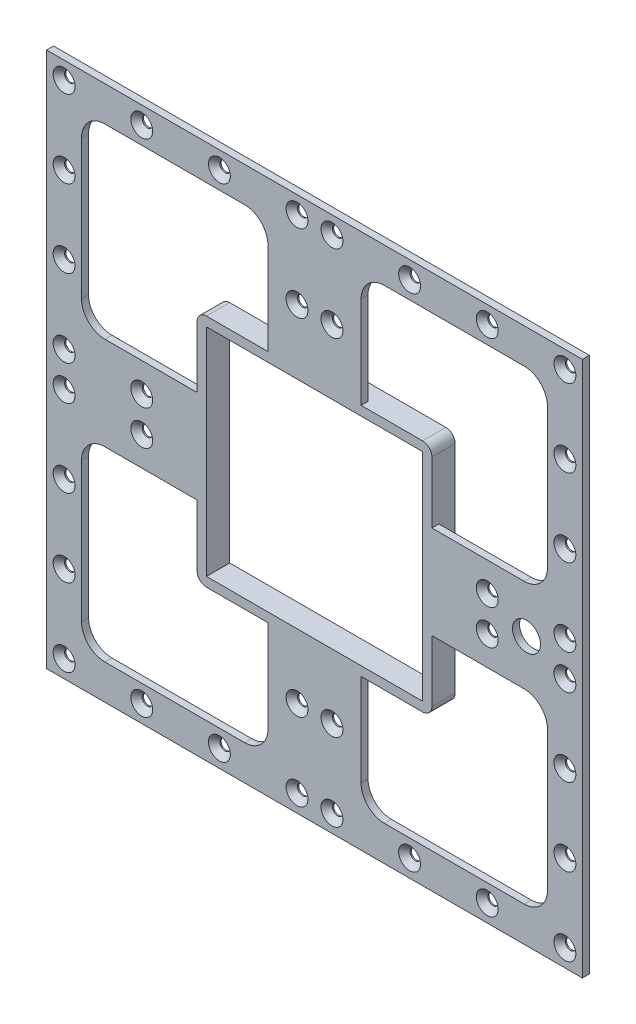
from build123d import *

# Parameters (mm, degrees)
SKETCH1_W              = 230
SKETCH1_H              = 230
BOSS_EXTRUDE1_DEPTH    = 3
SKETCH2_W              = 80
SKETCH2_H              = 80
CUT_EXTRUDE2_DEPTH     = 163.662226715
FILLET1_R              = 10
LPATTERN2_COUNT        = 2
LPATTERN2_PITCH        = 120
LPATTERN2_COUNT_DIR2   = 2
LPATTERN2_PITCH_DIR2   = 120
FILLET1_OF_LPATTERN2_R = 10
LPATTERN8_COUNT        = 4
LPATTERN8_PITCH        = 33.333333333
LPATTERN8_COUNT_DIR2   = 4
LPATTERN8_PITCH_DIR2   = 33.333333333
CUT_EXTRUDE3_REACH     = 164.662
SKETCH14_W             = 98
SKETCH14_H             = 98
SKETCH15_W             = 100.8
SKETCH15_H             = 100.8
SKETCH15_W_2           = 92.8
SKETCH15_H_2           = 92.8
BOSS_EXTRUDE2_DEPTH    = 10
FILLET2_R              = 4
CUT_EXTRUDE4_REACH     = 164.942
SKETCH16_R             = 6


with BuildPart() as part:
    # Sketch1 → Boss-Extrude1 (new body)
    with BuildSketch(Plane.XY):
        Rectangle(SKETCH1_W, SKETCH1_H)
    extrude(amount=BOSS_EXTRUDE1_DEPTH)

    # Sketch2 → Cut-Extrude2 (cut, through all)
    with BuildSketch(Plane.XY):
        with Locations((-60, 60)):
            Rectangle(SKETCH2_W, SKETCH2_H)
    cut_extrude2 = extrude(amount=CUT_EXTRUDE2_DEPTH, mode=Mode.SUBTRACT)

    # Fillet1
    fillet1_edges = [part.edges().sort_by_distance(p)[0] for p in [
        (-100, 100, 1.5),
        (-20, 100, 1.5),
        (-20, 20, 1.5),
        (-100, 20, 1.5),
    ]]
    fillet(fillet1_edges, radius=FILLET1_R)

    # LPattern2: Cut-Extrude2 2 × 2
    with Locations(*[(j * LPATTERN2_PITCH_DIR2, -i * LPATTERN2_PITCH, 0) for i in range(LPATTERN2_COUNT) for j in range(LPATTERN2_COUNT_DIR2) if (i, j) != (0, 0)]):
        add(cut_extrude2, mode=Mode.SUBTRACT)

    # Fillet1 of LPattern2
    fillet1_of_lpattern2_edges = [part.edges().sort_by_distance(p)[0] for p in [
        (20, 100, 1.5),
        (100, 100, 1.5),
        (100, 20, 1.5),
        (20, 20, 1.5),
        (-100, -20, 1.5),
        (-20, -20, 1.5),
        (-20, -100, 1.5),
        (-100, -100, 1.5),
        (20, -20, 1.5),
        (100, -20, 1.5),
        (100, -100, 1.5),
        (20, -100, 1.5),
    ]]
    fillet(fillet1_of_lpattern2_edges, radius=FILLET1_OF_LPATTERN2_R)

    # Sketch12 → CSK for M4 Flat Head Machine Screw4 (revolve, cut)
    with BuildSketch(Plane(origin=(-107.5, 107.5, 3), x_dir=(0, -1, 0), z_dir=(1, 0, 0))):
        Polygon((0, 0), (0, 3), (2.25, 3), (2.25, 2.45), (4.7, 0), align=None)
    csk_for_m4_flat_head_machine_screw4 = revolve(axis=Axis((-107.5, 107.5, 9.35), (0, 0, -1)), mode=Mode.SUBTRACT)

    # LPattern8: CSK for M4 Flat Head Machine Screw4 4 × 4, 4 skipped
    with Locations(*[(i * LPATTERN8_PITCH, -j * LPATTERN8_PITCH_DIR2, 0) for i in range(LPATTERN8_COUNT) for j in range(LPATTERN8_COUNT_DIR2) if (i, j) not in ((0, 0), (1, 1), (1, 2), (2, 1), (2, 2))]):
        add(csk_for_m4_flat_head_machine_screw4, mode=Mode.SUBTRACT)

    # Mirror1 copy 1 sketch → Mirror1 copy 1 (revolve, cut)
    with BuildSketch(Plane(origin=(107.5, 74.166666667, 3), x_dir=(0, -1, 0), z_dir=(-1, 0, 0))):
        Polygon((0, 0), (0, -3), (2.25, -3), (2.25, -2.45), (4.7, 0), align=None)
    revolve(axis=Axis((107.5, 74.166666667, 9.35), (0, 0, 1)), mode=Mode.SUBTRACT)

    # Mirror1 copy 2 sketch → Mirror1 copy 2 (revolve, cut)
    with BuildSketch(Plane(origin=(107.5, 40.833333333, 3), x_dir=(0, -1, 0), z_dir=(-1, 0, 0))):
        Polygon((0, 0), (0, -3), (2.25, -3), (2.25, -2.45), (4.7, 0), align=None)
    revolve(axis=Axis((107.5, 40.833333333, 9.35), (0, 0, 1)), mode=Mode.SUBTRACT)

    # Mirror1 copy 3 sketch → Mirror1 copy 3 (revolve, cut)
    with BuildSketch(Plane(origin=(107.5, 7.5, 3), x_dir=(0, -1, 0), z_dir=(-1, 0, 0))):
        Polygon((0, 0), (0, -3), (2.25, -3), (2.25, -2.45), (4.7, 0), align=None)
    revolve(axis=Axis((107.5, 7.5, 9.35), (0, 0, 1)), mode=Mode.SUBTRACT)

    # Mirror1 copy 4 sketch → Mirror1 copy 4 (revolve, cut)
    with BuildSketch(Plane(origin=(74.166666667, 107.5, 3), x_dir=(0, -1, 0), z_dir=(-1, 0, 0))):
        Polygon((0, 0), (0, -3), (2.25, -3), (2.25, -2.45), (4.7, 0), align=None)
    revolve(axis=Axis((74.166666667, 107.5, 9.35), (0, 0, 1)), mode=Mode.SUBTRACT)

    # Mirror1 copy 5 sketch → Mirror1 copy 5 (revolve, cut)
    with BuildSketch(Plane(origin=(74.166666667, 7.5, 3), x_dir=(0, -1, 0), z_dir=(-1, 0, 0))):
        Polygon((0, 0), (0, -3), (2.25, -3), (2.25, -2.45), (4.7, 0), align=None)
    revolve(axis=Axis((74.166666667, 7.5, 9.35), (0, 0, 1)), mode=Mode.SUBTRACT)

    # Mirror1 copy 6 sketch → Mirror1 copy 6 (revolve, cut)
    with BuildSketch(Plane(origin=(40.833333333, 107.5, 3), x_dir=(0, -1, 0), z_dir=(-1, 0, 0))):
        Polygon((0, 0), (0, -3), (2.25, -3), (2.25, -2.45), (4.7, 0), align=None)
    revolve(axis=Axis((40.833333333, 107.5, 9.35), (0, 0, 1)), mode=Mode.SUBTRACT)

    # Mirror1 copy 7 sketch → Mirror1 copy 7 (revolve, cut)
    with BuildSketch(Plane(origin=(40.833333333, 7.5, 3), x_dir=(0, -1, 0), z_dir=(-1, 0, 0))):
        Polygon((0, 0), (0, -3), (2.25, -3), (2.25, -2.45), (4.7, 0), align=None)
    revolve(axis=Axis((40.833333333, 7.5, 9.35), (0, 0, 1)), mode=Mode.SUBTRACT)

    # Mirror1 copy 8 sketch → Mirror1 copy 8 (revolve, cut)
    with BuildSketch(Plane(origin=(7.5, 107.5, 3), x_dir=(0, -1, 0), z_dir=(-1, 0, 0))):
        Polygon((0, 0), (0, -3), (2.25, -3), (2.25, -2.45), (4.7, 0), align=None)
    revolve(axis=Axis((7.5, 107.5, 9.35), (0, 0, 1)), mode=Mode.SUBTRACT)

    # Mirror1 copy 9 sketch → Mirror1 copy 9 (revolve, cut)
    with BuildSketch(Plane(origin=(7.5, 74.166666667, 3), x_dir=(0, -1, 0), z_dir=(-1, 0, 0))):
        Polygon((0, 0), (0, -3), (2.25, -3), (2.25, -2.45), (4.7, 0), align=None)
    revolve(axis=Axis((7.5, 74.166666667, 9.35), (0, 0, 1)), mode=Mode.SUBTRACT)

    # Mirror1 copy 10 sketch → Mirror1 copy 10 (revolve, cut)
    with BuildSketch(Plane(origin=(7.5, 40.833333333, 3), x_dir=(0, -1, 0), z_dir=(-1, 0, 0))):
        Polygon((0, 0), (0, -3), (2.25, -3), (2.25, -2.45), (4.7, 0), align=None)
    revolve(axis=Axis((7.5, 40.833333333, 9.35), (0, 0, 1)), mode=Mode.SUBTRACT)

    # Mirror1 copy 11 sketch → Mirror1 copy 11 (revolve, cut)
    with BuildSketch(Plane(origin=(7.5, 7.5, 3), x_dir=(0, -1, 0), z_dir=(-1, 0, 0))):
        Polygon((0, 0), (0, -3), (2.25, -3), (2.25, -2.45), (4.7, 0), align=None)
    revolve(axis=Axis((7.5, 7.5, 9.35), (0, 0, 1)), mode=Mode.SUBTRACT)

    # Mirror1 copy 12 sketch → Mirror1 copy 12 (revolve, cut)
    with BuildSketch(Plane(origin=(107.5, 107.5, 3), x_dir=(0, -1, 0), z_dir=(-1, 0, 0))):
        Polygon((0, 0), (0, -3), (2.25, -3), (2.25, -2.45), (4.7, 0), align=None)
    revolve(axis=Axis((107.5, 107.5, 9.35), (0, 0, 1)), mode=Mode.SUBTRACT)

    # Mirror1 at the second plane copy 1 sketc → Mirror1 at the second plane copy 1 (revolve, cut)
    with BuildSketch(Plane(origin=(-107.5, -74.166666667, 3), x_dir=(0, 1, 0), z_dir=(1, 0, 0))):
        Polygon((0, 0), (0, -3), (2.25, -3), (2.25, -2.45), (4.7, 0), align=None)
    revolve(axis=Axis((-107.5, -74.166666667, 9.35), (0, 0, 1)), mode=Mode.SUBTRACT)

    # Mirror1 at the second plane copy 2 sketc → Mirror1 at the second plane copy 2 (revolve, cut)
    with BuildSketch(Plane(origin=(-107.5, -40.833333333, 3), x_dir=(0, 1, 0), z_dir=(1, 0, 0))):
        Polygon((0, 0), (0, -3), (2.25, -3), (2.25, -2.45), (4.7, 0), align=None)
    revolve(axis=Axis((-107.5, -40.833333333, 9.35), (0, 0, 1)), mode=Mode.SUBTRACT)

    # Mirror1 at the second plane copy 3 sketc → Mirror1 at the second plane copy 3 (revolve, cut)
    with BuildSketch(Plane(origin=(-107.5, -7.5, 3), x_dir=(0, 1, 0), z_dir=(1, 0, 0))):
        Polygon((0, 0), (0, -3), (2.25, -3), (2.25, -2.45), (4.7, 0), align=None)
    revolve(axis=Axis((-107.5, -7.5, 9.35), (0, 0, 1)), mode=Mode.SUBTRACT)

    # Mirror1 at the second plane copy 4 sketc → Mirror1 at the second plane copy 4 (revolve, cut)
    with BuildSketch(Plane(origin=(-74.166666667, -107.5, 3), x_dir=(0, 1, 0), z_dir=(1, 0, 0))):
        Polygon((0, 0), (0, -3), (2.25, -3), (2.25, -2.45), (4.7, 0), align=None)
    revolve(axis=Axis((-74.166666667, -107.5, 9.35), (0, 0, 1)), mode=Mode.SUBTRACT)

    # Mirror1 at the second plane copy 5 sketc → Mirror1 at the second plane copy 5 (revolve, cut)
    with BuildSketch(Plane(origin=(-74.166666667, -7.5, 3), x_dir=(0, 1, 0), z_dir=(1, 0, 0))):
        Polygon((0, 0), (0, -3), (2.25, -3), (2.25, -2.45), (4.7, 0), align=None)
    revolve(axis=Axis((-74.166666667, -7.5, 9.35), (0, 0, 1)), mode=Mode.SUBTRACT)

    # Mirror1 at the second plane copy 6 sketc → Mirror1 at the second plane copy 6 (revolve, cut)
    with BuildSketch(Plane(origin=(-40.833333333, -107.5, 3), x_dir=(0, 1, 0), z_dir=(1, 0, 0))):
        Polygon((0, 0), (0, -3), (2.25, -3), (2.25, -2.45), (4.7, 0), align=None)
    revolve(axis=Axis((-40.833333333, -107.5, 9.35), (0, 0, 1)), mode=Mode.SUBTRACT)

    # Mirror1 at the second plane copy 7 sketc → Mirror1 at the second plane copy 7 (revolve, cut)
    with BuildSketch(Plane(origin=(-40.833333333, -7.5, 3), x_dir=(0, 1, 0), z_dir=(1, 0, 0))):
        Polygon((0, 0), (0, -3), (2.25, -3), (2.25, -2.45), (4.7, 0), align=None)
    revolve(axis=Axis((-40.833333333, -7.5, 9.35), (0, 0, 1)), mode=Mode.SUBTRACT)

    # Mirror1 at the second plane copy 8 sketc → Mirror1 at the second plane copy 8 (revolve, cut)
    with BuildSketch(Plane(origin=(-7.5, -107.5, 3), x_dir=(0, 1, 0), z_dir=(1, 0, 0))):
        Polygon((0, 0), (0, -3), (2.25, -3), (2.25, -2.45), (4.7, 0), align=None)
    revolve(axis=Axis((-7.5, -107.5, 9.35), (0, 0, 1)), mode=Mode.SUBTRACT)

    # Mirror1 at the second plane copy 9 sketc → Mirror1 at the second plane copy 9 (revolve, cut)
    with BuildSketch(Plane(origin=(-7.5, -74.166666667, 3), x_dir=(0, 1, 0), z_dir=(1, 0, 0))):
        Polygon((0, 0), (0, -3), (2.25, -3), (2.25, -2.45), (4.7, 0), align=None)
    revolve(axis=Axis((-7.5, -74.166666667, 9.35), (0, 0, 1)), mode=Mode.SUBTRACT)

    # Mirror1 at the second plane copy 10 sket → Mirror1 at the second plane copy 10 (revolve, cut)
    with BuildSketch(Plane(origin=(-7.5, -40.833333333, 3), x_dir=(0, 1, 0), z_dir=(1, 0, 0))):
        Polygon((0, 0), (0, -3), (2.25, -3), (2.25, -2.45), (4.7, 0), align=None)
    revolve(axis=Axis((-7.5, -40.833333333, 9.35), (0, 0, 1)), mode=Mode.SUBTRACT)

    # Mirror1 at the second plane copy 11 sket → Mirror1 at the second plane copy 11 (revolve, cut)
    with BuildSketch(Plane(origin=(-7.5, -7.5, 3), x_dir=(0, 1, 0), z_dir=(1, 0, 0))):
        Polygon((0, 0), (0, -3), (2.25, -3), (2.25, -2.45), (4.7, 0), align=None)
    revolve(axis=Axis((-7.5, -7.5, 9.35), (0, 0, 1)), mode=Mode.SUBTRACT)

    # Mirror1 at the second plane copy 12 sket → Mirror1 at the second plane copy 12 (revolve, cut)
    with BuildSketch(Plane(origin=(-107.5, -107.5, 3), x_dir=(0, 1, 0), z_dir=(1, 0, 0))):
        Polygon((0, 0), (0, -3), (2.25, -3), (2.25, -2.45), (4.7, 0), align=None)
    revolve(axis=Axis((-107.5, -107.5, 9.35), (0, 0, 1)), mode=Mode.SUBTRACT)

    # Mirror1 at the second plane copy 13 sket → Mirror1 at the second plane copy 13 (revolve, cut)
    with BuildSketch(Plane(origin=(107.5, -74.166666667, 3), x_dir=(0, 1, 0), z_dir=(-1, 0, 0))):
        Polygon((0, 0), (0, 3), (2.25, 3), (2.25, 2.45), (4.7, 0), align=None)
    revolve(axis=Axis((107.5, -74.166666667, 9.35), (0, 0, -1)), mode=Mode.SUBTRACT)

    # Mirror1 at the second plane copy 14 sket → Mirror1 at the second plane copy 14 (revolve, cut)
    with BuildSketch(Plane(origin=(107.5, -40.833333333, 3), x_dir=(0, 1, 0), z_dir=(-1, 0, 0))):
        Polygon((0, 0), (0, 3), (2.25, 3), (2.25, 2.45), (4.7, 0), align=None)
    revolve(axis=Axis((107.5, -40.833333333, 9.35), (0, 0, -1)), mode=Mode.SUBTRACT)

    # Mirror1 at the second plane copy 15 sket → Mirror1 at the second plane copy 15 (revolve, cut)
    with BuildSketch(Plane(origin=(107.5, -7.5, 3), x_dir=(0, 1, 0), z_dir=(-1, 0, 0))):
        Polygon((0, 0), (0, 3), (2.25, 3), (2.25, 2.45), (4.7, 0), align=None)
    revolve(axis=Axis((107.5, -7.5, 9.35), (0, 0, -1)), mode=Mode.SUBTRACT)

    # Mirror1 at the second plane copy 16 sket → Mirror1 at the second plane copy 16 (revolve, cut)
    with BuildSketch(Plane(origin=(74.166666667, -107.5, 3), x_dir=(0, 1, 0), z_dir=(-1, 0, 0))):
        Polygon((0, 0), (0, 3), (2.25, 3), (2.25, 2.45), (4.7, 0), align=None)
    revolve(axis=Axis((74.166666667, -107.5, 9.35), (0, 0, -1)), mode=Mode.SUBTRACT)

    # Mirror1 at the second plane copy 17 sket → Mirror1 at the second plane copy 17 (revolve, cut)
    with BuildSketch(Plane(origin=(74.166666667, -7.5, 3), x_dir=(0, 1, 0), z_dir=(-1, 0, 0))):
        Polygon((0, 0), (0, 3), (2.25, 3), (2.25, 2.45), (4.7, 0), align=None)
    revolve(axis=Axis((74.166666667, -7.5, 9.35), (0, 0, -1)), mode=Mode.SUBTRACT)

    # Mirror1 at the second plane copy 18 sket → Mirror1 at the second plane copy 18 (revolve, cut)
    with BuildSketch(Plane(origin=(40.833333333, -107.5, 3), x_dir=(0, 1, 0), z_dir=(-1, 0, 0))):
        Polygon((0, 0), (0, 3), (2.25, 3), (2.25, 2.45), (4.7, 0), align=None)
    revolve(axis=Axis((40.833333333, -107.5, 9.35), (0, 0, -1)), mode=Mode.SUBTRACT)

    # Mirror1 at the second plane copy 19 sket → Mirror1 at the second plane copy 19 (revolve, cut)
    with BuildSketch(Plane(origin=(40.833333333, -7.5, 3), x_dir=(0, 1, 0), z_dir=(-1, 0, 0))):
        Polygon((0, 0), (0, 3), (2.25, 3), (2.25, 2.45), (4.7, 0), align=None)
    revolve(axis=Axis((40.833333333, -7.5, 9.35), (0, 0, -1)), mode=Mode.SUBTRACT)

    # Mirror1 at the second plane copy 20 sket → Mirror1 at the second plane copy 20 (revolve, cut)
    with BuildSketch(Plane(origin=(7.5, -107.5, 3), x_dir=(0, 1, 0), z_dir=(-1, 0, 0))):
        Polygon((0, 0), (0, 3), (2.25, 3), (2.25, 2.45), (4.7, 0), align=None)
    revolve(axis=Axis((7.5, -107.5, 9.35), (0, 0, -1)), mode=Mode.SUBTRACT)

    # Mirror1 at the second plane copy 21 sket → Mirror1 at the second plane copy 21 (revolve, cut)
    with BuildSketch(Plane(origin=(7.5, -74.166666667, 3), x_dir=(0, 1, 0), z_dir=(-1, 0, 0))):
        Polygon((0, 0), (0, 3), (2.25, 3), (2.25, 2.45), (4.7, 0), align=None)
    revolve(axis=Axis((7.5, -74.166666667, 9.35), (0, 0, -1)), mode=Mode.SUBTRACT)

    # Mirror1 at the second plane copy 22 sket → Mirror1 at the second plane copy 22 (revolve, cut)
    with BuildSketch(Plane(origin=(7.5, -40.833333333, 3), x_dir=(0, 1, 0), z_dir=(-1, 0, 0))):
        Polygon((0, 0), (0, 3), (2.25, 3), (2.25, 2.45), (4.7, 0), align=None)
    revolve(axis=Axis((7.5, -40.833333333, 9.35), (0, 0, -1)), mode=Mode.SUBTRACT)

    # Mirror1 at the second plane copy 23 sket → Mirror1 at the second plane copy 23 (revolve, cut)
    with BuildSketch(Plane(origin=(7.5, -7.5, 3), x_dir=(0, 1, 0), z_dir=(-1, 0, 0))):
        Polygon((0, 0), (0, 3), (2.25, 3), (2.25, 2.45), (4.7, 0), align=None)
    revolve(axis=Axis((7.5, -7.5, 9.35), (0, 0, -1)), mode=Mode.SUBTRACT)

    # Mirror1 at the second plane copy 24 sket → Mirror1 at the second plane copy 24 (revolve, cut)
    with BuildSketch(Plane(origin=(107.5, -107.5, 3), x_dir=(0, 1, 0), z_dir=(-1, 0, 0))):
        Polygon((0, 0), (0, 3), (2.25, 3), (2.25, 2.45), (4.7, 0), align=None)
    revolve(axis=Axis((107.5, -107.5, 9.35), (0, 0, -1)), mode=Mode.SUBTRACT)

    # Mirror1 at the second plane copy 25 sket → Mirror1 at the second plane copy 25 (revolve, cut)
    with BuildSketch(Plane(origin=(-107.5, -107.5, 3), x_dir=(0, 1, 0), z_dir=(1, 0, 0))):
        Polygon((0, 0), (0, -3), (2.25, -3), (2.25, -2.45), (4.7, 0), align=None)
    revolve(axis=Axis((-107.5, -107.5, 9.35), (0, 0, 1)), mode=Mode.SUBTRACT)

    # Sketch14 → Cut-Extrude3 (cut, up to next)
    with BuildSketch(Plane.XY.offset(3), mode=Mode.PRIVATE) as cut_extrude3_sk1:
        Rectangle(SKETCH14_W, SKETCH14_H)
    cut_extrude3_tool1 = extrude(cut_extrude3_sk1.sketch, amount=-CUT_EXTRUDE3_REACH, mode=Mode.PRIVATE) & part.part
    add(cut_extrude3_tool1.solids().sort_by_distance((0, 0, 3))[0], mode=Mode.SUBTRACT)

    # Sketch15 → Boss-Extrude2 (add)
    with BuildSketch(Plane.XY.offset(3)):
        Rectangle(SKETCH15_W, SKETCH15_H)
        Rectangle(SKETCH15_W_2, SKETCH15_H_2, mode=Mode.SUBTRACT)
    extrude(amount=-BOSS_EXTRUDE2_DEPTH)

    # Fillet2
    fillet2_edges = [part.edges().sort_by_distance(p)[0] for p in [
        (-50.4, -50.4, -2),
        (50.4, -50.4, -2),
        (50.4, 50.4, -2),
        (-50.4, 50.4, -2),
    ]]
    fillet(fillet2_edges, radius=FILLET2_R)

    # Sketch16 → Cut-Extrude4 (cut, up to next)
    with BuildSketch(Plane.XY.offset(3), mode=Mode.PRIVATE) as cut_extrude4_sk1:
        with Locations((91, 0)):
            Circle(SKETCH16_R)
    cut_extrude4_tool1 = extrude(cut_extrude4_sk1.sketch, amount=-CUT_EXTRUDE4_REACH, mode=Mode.PRIVATE) & part.part
    add(cut_extrude4_tool1.solids().sort_by_distance((91, 0, 3))[0], mode=Mode.SUBTRACT)


solid = part.part
